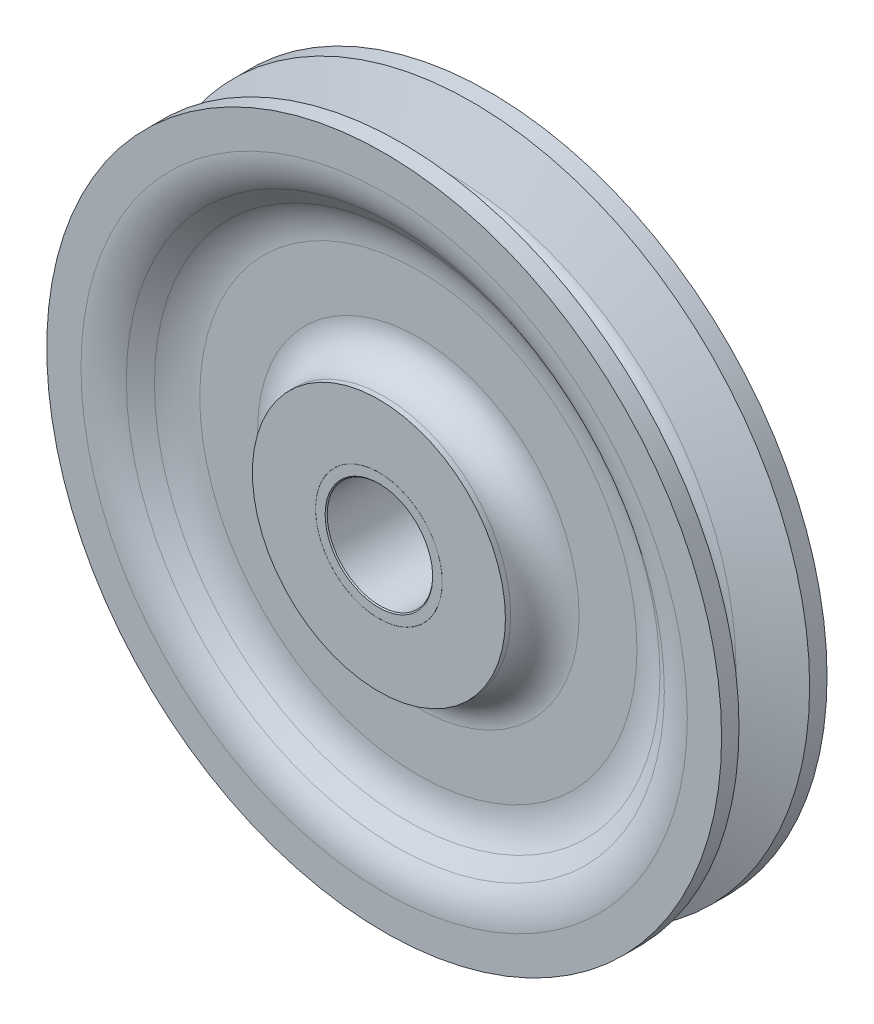
from build123d import *
from build123d.topology import SkipClean

# Parameters (mm, degrees)
CUT_EXTRUDE_THIN1_DEPTH      = 145.741351749
CUT_EXTRUDE_THIN1_DEPTH_BACK = 145.741351749
SKETCH2_R                    = 19.0754
SKETCH2_R_2                  = 19.05
CHAMFER1_SIZE                = 0.3175
FILLET2_R                    = 17.439239198
FILLET3_R                    = 10.287


with BuildPart() as part:
    # Sketch1 → Revolve1 (revolve)
    with BuildSketch(Plane(origin=(0, 0, 0), x_dir=(0, 0, -1), z_dir=(1, 0, 0)), mode=Mode.PRIVATE) as revolve1_sk:
        with BuildLine():
            Line((10.63625, 101.6), (15.875, 101.6))
            Line((15.875, 101.6), (15.875, 38.1))
            Line((15.875, 38.1), (17.4625, 38.1))
            Line((17.4625, 38.1), (17.4625, 19.05))
            Line((17.4625, 19.05), (17.4625, 15.875))
            Line((17.4625, 15.875), (-17.4625, 15.875))
            Line((-17.4625, 15.875), (-17.4625, 19.05))
            Line((-17.4625, 19.05), (-17.4625, 38.1))
            Line((-17.4625, 38.1), (-15.875, 38.1))
            Line((-15.875, 38.1), (-15.875, 101.6))
            Line((-15.875, 101.6), (-10.63625, 101.6))
            Line((-10.63625, 101.6), (-4.441473336, 85.59356985))
            ThreePointArc((-4.441473336, 85.59356985), (0, 82.55), (4.441473336, 85.59356985))
            Line((4.441473336, 85.59356985), (10.63625, 101.6))
        make_face()
    revolve(revolve1_sk.sketch.rotate(Axis((0, 0, 17.4625), (0, 0, -1)), 90), axis=Axis((0, 0, 17.4625), (0, 0, -1)))

    # Sketch2 → Cut-Extrude-Thin1 (cut, two sides: drawn at the far end of the back side and taken through both)
    with BuildSketch(Plane.XY.offset(-CUT_EXTRUDE_THIN1_DEPTH_BACK)):
        Circle(SKETCH2_R)
        Circle(SKETCH2_R_2, mode=Mode.SUBTRACT)
    extrude(amount=CUT_EXTRUDE_THIN1_DEPTH + CUT_EXTRUDE_THIN1_DEPTH_BACK, mode=Mode.SUBTRACT)


with BuildPart() as cut_extrude_thin1_piece_1:
    # of the separate pieces the step leaves, piece 1, a body of its own (cut_extrude_thin1_pieces)
    add(part.part.solids().sort_by_distance((85.59356985, 0, -4.441473336))[0])

    # Sketch3 → Cut-Revolve1 (revolve, cut)
    with SkipClean():  # the faces are left unmerged after this step: merging them gives an invalid solid
        with BuildSketch(Plane(origin=(0, 0, 0), x_dir=(0, 0, -1), z_dir=(1, 0, 0)), mode=Mode.PRIVATE) as cut_revolve1_sk:
            Polygon((-15.875, 38.1), (-5.588, 38.1), (-5.588, 71.511499875), (-15.875, 85.59356985), align=None)
        cut_revolve1 = revolve(cut_revolve1_sk.sketch.rotate(Axis((0, 0, 5.588), (0, 0, 1)), 90), axis=Axis((0, 0, 5.588), (0, 0, 1)), mode=Mode.SUBTRACT)

    # Mirror1: Cut-Revolve1 across plane
    with SkipClean():  # the faces are left unmerged after this step: merging them gives an invalid solid
        add(cut_revolve1.mirror(Plane.XY), mode=Mode.SUBTRACT)

    # Fillet2
    fillet2_edges = [cut_extrude_thin1_piece_1.edges().sort_by_distance(p)[0] for p in [
        (71.511499875, 0, 5.588),
        (85.59356985, 0, 15.875),
        (85.59356985, 0, -15.875),
        (71.511499875, 0, -5.588),
    ]]
    fillet(fillet2_edges, radius=FILLET2_R)

    # Fillet3
    fillet3_edges = [cut_extrude_thin1_piece_1.edges().sort_by_distance(p)[0] for p in [
        (38.1, 0, 5.588),
        (38.1, 0, -5.588),
    ]]
    fillet(fillet3_edges, radius=FILLET3_R - 0.0001)  # a hair under: the kernel refuses the full size


with BuildPart() as cut_extrude_thin1_piece_2:
    # of the separate pieces the step leaves, piece 2, a body of its own (cut_extrude_thin1_pieces)
    add(part.part.solids().sort_by_distance((19.05, 0, -17.4625))[0])

    # Chamfer1
    chamfer1_edges = [cut_extrude_thin1_piece_2.edges().sort_by_distance(p)[0] for p in [
        (-15.875, 0, -17.4625),
        (-15.875, 0, 17.4625),
    ]]
    chamfer(chamfer1_edges, length=CHAMFER1_SIZE)


solid = Compound([cut_extrude_thin1_piece_1.part, cut_extrude_thin1_piece_2.part])
